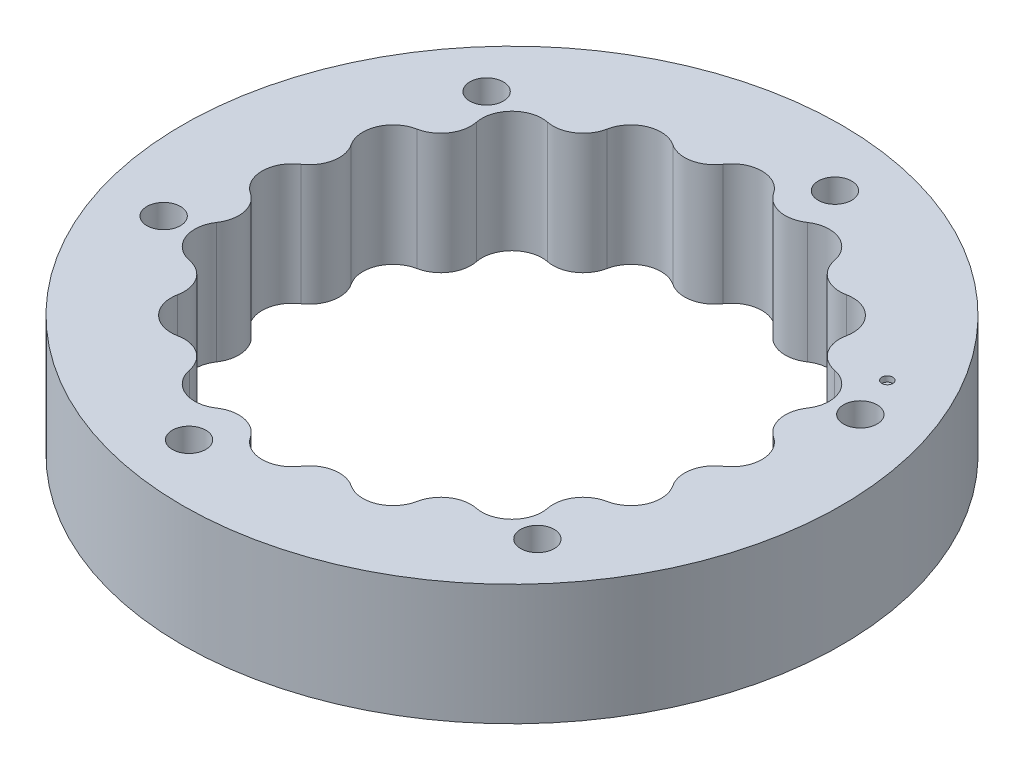
from build123d import *

# Parameters (mm, degrees)
SKETCH1_R           = 60
BOSS_EXTRUDE1_DEPTH = 22
FILLET1_R           = 5
FILLET2_R           = 6
SKETCH3_R           = 3.05
CUT_EXTRUDE1_DEPTH  = 88.658428165
SKETCH9_R           = 1
CUT_EXTRUDE5_DEPTH  = 1
CUT_EXTRUDE7_DEPTH  = 88.658428165


with BuildPart() as part:
    # Sketch1 → Boss-Extrude1 (new body)
    with BuildSketch(Plane(origin=(0, 0, 0), x_dir=(1, 0, 0), z_dir=(0, 1, 0))):
        with Locations(Location((0, 0, 0), (0, 0, 270))):
            Circle(SKETCH1_R)
        with BuildLine():
            ThreePointArc((-31.591922188, 24.534678569), (-33.258784492, 22.222809321), (-34.756792584, 19.798115295))
            ThreePointArc((-34.756792584, 19.798115295), (-41.574578963, 17.220754456), (-38.576145309, 10.577382149))
            ThreePointArc((-38.576145309, 10.577382149), (-39.231411216, 7.803612881), (-39.6875, 4.99022482))
            ThreePointArc((-39.6875, 4.99022482), (-45, 0), (-39.6875, -4.99022482))
            ThreePointArc((-39.6875, -4.99022482), (-39.231411216, -7.803612881), (-38.576145309, -10.577382149))
            ThreePointArc((-38.576145309, -10.577382149), (-41.574578963, -17.220754456), (-34.756792584, -19.798115295))
            ThreePointArc((-34.756792584, -19.798115295), (-33.258784492, -22.222809321), (-31.591922188, -24.534678569))
            ThreePointArc((-31.591922188, -24.534678569), (-31.819805153, -31.819805153), (-24.534678569, -31.591922188))
            ThreePointArc((-24.534678569, -31.591922188), (-22.222809321, -33.258784492), (-19.798115295, -34.756792584))
            ThreePointArc((-19.798115295, -34.756792584), (-17.220754456, -41.574578963), (-10.577382149, -38.576145309))
            ThreePointArc((-10.577382149, -38.576145309), (-7.803612881, -39.231411216), (-4.99022482, -39.6875))
            ThreePointArc((-4.99022482, -39.6875), (0, -45), (4.99022482, -39.6875))
            ThreePointArc((4.99022482, -39.6875), (7.803612881, -39.231411216), (10.577382149, -38.576145309))
            ThreePointArc((10.577382149, -38.576145309), (17.220754456, -41.574578963), (19.798115295, -34.756792584))
            ThreePointArc((19.798115295, -34.756792584), (22.222809321, -33.258784492), (24.534678569, -31.591922188))
            ThreePointArc((24.534678569, -31.591922188), (31.819805153, -31.819805153), (31.591922188, -24.534678569))
            ThreePointArc((31.591922188, -24.534678569), (33.258784492, -22.222809321), (34.756792584, -19.798115295))
            ThreePointArc((34.756792584, -19.798115295), (41.574578963, -17.220754456), (38.576145309, -10.577382149))
            ThreePointArc((38.576145309, -10.577382149), (39.231411216, -7.803612881), (39.6875, -4.99022482))
            ThreePointArc((39.6875, -4.99022482), (45, 0), (39.6875, 4.99022482))
            ThreePointArc((39.6875, 4.99022482), (39.231411216, 7.803612881), (38.576145309, 10.577382149))
            ThreePointArc((38.576145309, 10.577382149), (41.574578963, 17.220754456), (34.756792584, 19.798115295))
            ThreePointArc((34.756792584, 19.798115295), (33.258784492, 22.222809321), (31.591922188, 24.534678569))
            ThreePointArc((31.591922188, 24.534678569), (31.819805153, 31.819805153), (24.534678569, 31.591922188))
            ThreePointArc((24.534678569, 31.591922188), (22.222809321, 33.258784492), (19.798115295, 34.756792584))
            ThreePointArc((19.798115295, 34.756792584), (17.220754456, 41.574578963), (10.577382149, 38.576145309))
            ThreePointArc((10.577382149, 38.576145309), (7.803612881, 39.231411216), (4.99022482, 39.6875))
            ThreePointArc((4.99022482, 39.6875), (0, 45), (-4.99022482, 39.6875))
            ThreePointArc((-4.99022482, 39.6875), (-7.803612881, 39.231411216), (-10.577382149, 38.576145309))
            ThreePointArc((-10.577382149, 38.576145309), (-17.220754456, 41.574578963), (-19.798115295, 34.756792584))
            ThreePointArc((-19.798115295, 34.756792584), (-22.222809321, 33.258784492), (-24.534678569, 31.591922188))
            ThreePointArc((-24.534678569, 31.591922188), (-31.819805153, 31.819805153), (-31.591922188, 24.534678569))
        make_face(mode=Mode.SUBTRACT)
    extrude(amount=BOSS_EXTRUDE1_DEPTH)

    # Fillet1
    # the kernel refuses this fillet: 5 mm, written as the material it takes off along each edge
    with BuildSketch(Plane(origin=(-31.591922188, -7.937782114, -24.534678569), x_dir=(-0.5708127348451637, 0, -0.8210802772802334), z_dir=(0, 1, 0))) as fillet1_piece_1:
        with BuildLine():
            CenterArc((3.572001951, 4.856162203), FILLET1_R, 201.908932705, 54.314665287)
            ThreePointArc((-1.066888508, 2.990500041), (-0.503760138, 1.505840103), (0, 0))
            ThreePointArc((0, 0), (1.190667317, 0.143837797), (2.381334634, 0))
        make_face()
    extrude(amount=37.875564228, mode=Mode.SUBTRACT)
    with BuildSketch(Plane(origin=(-34.756792584, -7.937782114, -19.798115295), x_dir=(-0.977019839336146, 0, -0.21314838386338178), z_dir=(0, 1, 0)), Plane(origin=(10.577382149, -7.937782114, 38.576145309), x_dir=(0.5401386861196337, 0, 0.8415760213771278), z_dir=(0, 1, 0)), Plane(origin=(-4.99022482, -7.937782114, 39.6875), x_dir=(0.176965876366712, 0, 0.984216987560041), z_dir=(0, 1, 0)), Plane(origin=(-19.798115295, -7.937782114, 34.756792584), x_dir=(-0.21314838386337953, 0, 0.9770198393361466), z_dir=(0, 1, 0)), Plane(origin=(-31.591922188, -7.937782114, 24.534678569), x_dir=(-0.5708127348451787, 0, 0.8210802772802229), z_dir=(0, 1, 0)), Plane(origin=(-38.576145309, -7.937782114, 10.577382149), x_dir=(-0.84157602137713, 0, 0.5401386861196305), z_dir=(0, 1, 0)), Plane(origin=(-39.6875, -7.937782114, -4.99022482), x_dir=(-0.9842169875600411, 0, 0.17696587636671054), z_dir=(0, 1, 0)), Plane(origin=(24.534678569, -7.937782114, 31.591922188), x_dir=(0.8210802772802258, 0, 0.5708127348451744), z_dir=(0, 1, 0)), Plane(origin=(34.756792584, -7.937782114, 19.798115295), x_dir=(0.9770198393361469, 0, 0.2131483838633775), z_dir=(0, 1, 0)), Plane(origin=(39.6875, -7.937782114, 4.99022482), x_dir=(0.9842169875600401, 0, -0.1769658763667165), z_dir=(0, 1, 0)), Plane(origin=(38.576145309, -7.937782114, -10.577382149), x_dir=(0.8415760213771245, 0, -0.5401386861196388), z_dir=(0, 1, 0)), Plane(origin=(31.591922188, -7.937782114, -24.534678569), x_dir=(0.5708127348451758, 0, -0.8210802772802248), z_dir=(0, 1, 0)), Plane(origin=(19.798115295, -7.937782114, -34.756792584), x_dir=(0.21314838386337198, 0, -0.9770198393361482), z_dir=(0, 1, 0)), Plane(origin=(4.99022482, -7.937782114, -39.6875), x_dir=(-0.17696587636672031, 0, -0.9842169875600394), z_dir=(0, 1, 0)), Plane(origin=(-10.577382149, -7.937782114, -38.576145309), x_dir=(-0.5401386861196261, 0, -0.8415760213771326), z_dir=(0, 1, 0)), Plane(origin=(-24.534678569, -7.937782114, -31.591922188), x_dir=(-0.82108027728022, 0, -0.5708127348451829), z_dir=(0, 1, 0))) as fillet1_piece_2:
        with BuildLine():
            CenterArc((3.572001951, -4.856162203), FILLET1_R, 103.776402008, 54.314665287)
            ThreePointArc((-1.066888508, -2.990500041), (-0.503760138, -1.505840103), (0, 0))
            ThreePointArc((0, 0), (1.190667317, -0.143837797), (2.381334634, 0))
        make_face()
    extrude(amount=37.875564228, mode=Mode.SUBTRACT)
    with BuildSketch(Plane(origin=(4.99022482, -7.937782114, 39.6875), x_dir=(0.9864543257067245, 0, -0.1640361645933343), z_dir=(0, 1, 0)), Plane(origin=(-10.577382149, -7.937782114, 38.576145309), x_dir=(0.9741388837762464, 0, 0.22595007217340898), z_dir=(0, 1, 0)), Plane(origin=(-24.534678569, -7.937782114, 31.591922188), x_dir=(0.8135196273818055, 0, 0.5815374586942516), z_dir=(0, 1, 0)), Plane(origin=(-34.756792584, -7.937782114, 19.798115295), x_dir=(0.5290493822922732, 0, 0.8485910387790836), z_dir=(0, 1, 0)), Plane(origin=(-39.6875, -7.937782114, 4.99022482), x_dir=(0.1640361645933272, 0, 0.9864543257067256), z_dir=(0, 1, 0)), Plane(origin=(-38.576145309, -7.937782114, -10.577382149), x_dir=(-0.22595007217340937, 0, 0.9741388837762464), z_dir=(0, 1, 0)), Plane(origin=(19.798115295, -7.937782114, 34.756792584), x_dir=(0.8485910387790846, 0, -0.5290493822922715), z_dir=(0, 1, 0)), Plane(origin=(31.591922188, -7.937782114, 24.534678569), x_dir=(0.5815374586942491, 0, -0.8135196273818073), z_dir=(0, 1, 0)), Plane(origin=(38.576145309, -7.937782114, 10.577382149), x_dir=(0.22595007217340277, 0, -0.9741388837762479), z_dir=(0, 1, 0)), Plane(origin=(39.6875, -7.937782114, -4.99022482), x_dir=(-0.16403616459333684, 0, -0.9864543257067241), z_dir=(0, 1, 0)), Plane(origin=(34.756792584, -7.937782114, -19.798115295), x_dir=(-0.5290493822922758, 0, -0.8485910387790819), z_dir=(0, 1, 0)), Plane(origin=(24.534678569, -7.937782114, -31.591922188), x_dir=(-0.8135196273818096, 0, -0.5815374586942458), z_dir=(0, 1, 0)), Plane(origin=(10.577382149, -7.937782114, -38.576145309), x_dir=(-0.9741388837762485, 0, -0.22595007217340046), z_dir=(0, 1, 0)), Plane(origin=(-4.99022482, -7.937782114, -39.6875), x_dir=(-0.9864543257067236, 0, 0.16403616459333964), z_dir=(0, 1, 0)), Plane(origin=(-19.798115295, -7.937782114, -34.756792584), x_dir=(-0.8485910387790874, 0, 0.5290493822922673), z_dir=(0, 1, 0))) as fillet1_piece_3:
        with BuildLine():
            CenterArc((3.373557398, -4.996060424), FILLET1_R, 92.274604499, 54.314665287)
            ThreePointArc((-0.800166381, -2.24287503), (-0.264608655, -1.169769307), (0, 0))
            ThreePointArc((0, 0), (1.587556423, -0.031516609), (3.175112846, 0))
        make_face()
    extrude(amount=37.875564228, mode=Mode.SUBTRACT)

    # Fillet2
    fillet2_edges = [part.edges().sort_by_distance(p)[0] for p in [
        (-7.805937782, 11, 39.243099283),
        (7.805937782, 11, 39.243099283),
        (22.229430079, 11, 33.268693157),
        (33.268693157, 11, 22.229430079),
        (-22.229430079, 11, 33.268693157),
        (-33.268693157, 11, 22.229430079),
        (-39.243099283, 11, 7.805937782),
        (-39.243099283, 11, -7.805937782),
        (39.243099283, 11, 7.805937782),
        (39.243099283, 11, -7.805937782),
        (33.268693157, 11, -22.229430079),
        (22.229430079, 11, -33.268693157),
        (7.805937782, 11, -39.243099283),
        (-7.805937782, 11, -39.243099283),
        (-22.229430079, 11, -33.268693157),
        (-33.268693157, 11, -22.229430079),
    ]]
    fillet(fillet2_edges, radius=FILLET2_R)

    # Sketch3 → Cut-Extrude1 (cut, through all)
    with BuildSketch(Plane(origin=(0, 22, 0), x_dir=(1, 0, 0), z_dir=(0, 1, 0))):
        with Locations(Location((9.754516101, 49.03926402, 0), (0, 0, 270))):
            Circle(SKETCH3_R)
        with Locations(Location((47.346506475, 16.071973265, 0), (0, 0, 270))):
            Circle(SKETCH3_R)
        with Locations(Location((37.591990374, -32.967290755, 0), (0, 0, 270))):
            Circle(SKETCH3_R)
        with Locations(Location((-9.754516101, -49.03926402, 0), (0, 0, 270))):
            Circle(SKETCH3_R)
        with Locations(Location((-47.346506475, -16.071973265, 0), (0, 0, 270))):
            Circle(SKETCH3_R)
        with Locations(Location((-37.591990374, 32.967290755, 0), (0, 0, 270))):
            Circle(SKETCH3_R)
    extrude(amount=-CUT_EXTRUDE1_DEPTH, mode=Mode.SUBTRACT)

    # Sketch9 → Cut-Extrude5 (cut)
    with BuildSketch(Plane(origin=(0, 22, 0), x_dir=(1, 0, 0), z_dir=(0, 1, 0))):
        with Locations(Location((44.425227151, 23.905313753, 0), (0, 0, 270))):
            Circle(SKETCH9_R)
    extrude(amount=-CUT_EXTRUDE5_DEPTH, mode=Mode.SUBTRACT)

    # Sketch11 → Cut-Extrude7 (cut, through all)
    with BuildSketch(Plane(origin=(0, 22, 0), x_dir=(1, 0, 0), z_dir=(0, 1, 0))):
        with BuildLine():
            ThreePointArc((-43.040639218, 4.583068093), (-45.5, 0), (-43.040639218, -4.583068093))
            ThreePointArc((-43.040639218, -4.583068093), (-40.686959394, -8.093139415), (-41.518229869, -12.23673674))
            ThreePointArc((-41.518229869, -12.23673674), (-42.036518729, -17.412096173), (-38.010501411, -20.705142354))
            ThreePointArc((-38.010501411, -20.705142354), (-34.492738655, -23.047311133), (-33.675046385, -27.193609331))
            ThreePointArc((-33.675046385, -27.193609331), (-32.173358544, -32.173358544), (-27.193609331, -33.675046385))
            ThreePointArc((-27.193609331, -33.675046385), (-23.047311133, -34.492738655), (-20.705142354, -38.010501411))
            ThreePointArc((-20.705142354, -38.010501411), (-17.412096173, -42.036518729), (-12.23673674, -41.518229869))
            ThreePointArc((-12.23673674, -41.518229869), (-8.093139415, -40.686959394), (-4.583068093, -43.040639218))
            ThreePointArc((-4.583068093, -43.040639218), (0, -45.5), (4.583068093, -43.040639218))
            ThreePointArc((4.583068093, -43.040639218), (8.093139415, -40.686959394), (12.23673674, -41.518229869))
            ThreePointArc((12.23673674, -41.518229869), (17.412096173, -42.036518729), (20.705142354, -38.010501411))
            ThreePointArc((20.705142354, -38.010501411), (23.047311133, -34.492738655), (27.193609331, -33.675046385))
            ThreePointArc((27.193609331, -33.675046385), (32.173358544, -32.173358544), (33.675046385, -27.193609331))
            ThreePointArc((33.675046385, -27.193609331), (34.492738655, -23.047311133), (38.010501411, -20.705142354))
            ThreePointArc((38.010501411, -20.705142354), (42.036518729, -17.412096173), (41.518229869, -12.23673674))
            ThreePointArc((41.518229869, -12.23673674), (40.686959394, -8.093139415), (43.040639218, -4.583068093))
            ThreePointArc((43.040639218, -4.583068093), (45.5, 0), (43.040639218, 4.583068093))
            ThreePointArc((43.040639218, 4.583068093), (40.686959394, 8.093139415), (41.518229869, 12.23673674))
            ThreePointArc((41.518229869, 12.23673674), (42.036518729, 17.412096173), (38.010501411, 20.705142354))
            ThreePointArc((38.010501411, 20.705142354), (34.492738655, 23.047311133), (33.675046385, 27.193609331))
            ThreePointArc((33.675046385, 27.193609331), (32.173358544, 32.173358544), (27.193609331, 33.675046385))
            ThreePointArc((27.193609331, 33.675046385), (23.047311133, 34.492738655), (20.705142354, 38.010501411))
            ThreePointArc((20.705142354, 38.010501411), (17.412096173, 42.036518729), (12.23673674, 41.518229869))
            ThreePointArc((12.23673674, 41.518229869), (8.093139415, 40.686959394), (4.583068093, 43.040639218))
            ThreePointArc((4.583068093, 43.040639218), (0, 45.5), (-4.583068093, 43.040639218))
            ThreePointArc((-4.583068093, 43.040639218), (-8.093139415, 40.686959394), (-12.23673674, 41.518229869))
            ThreePointArc((-12.23673674, 41.518229869), (-17.412096173, 42.036518729), (-20.705142354, 38.010501411))
            ThreePointArc((-20.705142354, 38.010501411), (-23.047311133, 34.492738655), (-27.193609331, 33.675046385))
            ThreePointArc((-27.193609331, 33.675046385), (-32.173358544, 32.173358544), (-33.675046385, 27.193609331))
            ThreePointArc((-33.675046385, 27.193609331), (-34.492738655, 23.047311133), (-38.010501411, 20.705142354))
            ThreePointArc((-38.010501411, 20.705142354), (-42.036518729, 17.412096173), (-41.518229869, 12.23673674))
            ThreePointArc((-41.518229869, 12.23673674), (-40.686959394, 8.093139415), (-43.040639218, 4.583068093))
        make_face()
    extrude(amount=-CUT_EXTRUDE7_DEPTH, mode=Mode.SUBTRACT)


solid = part.part
